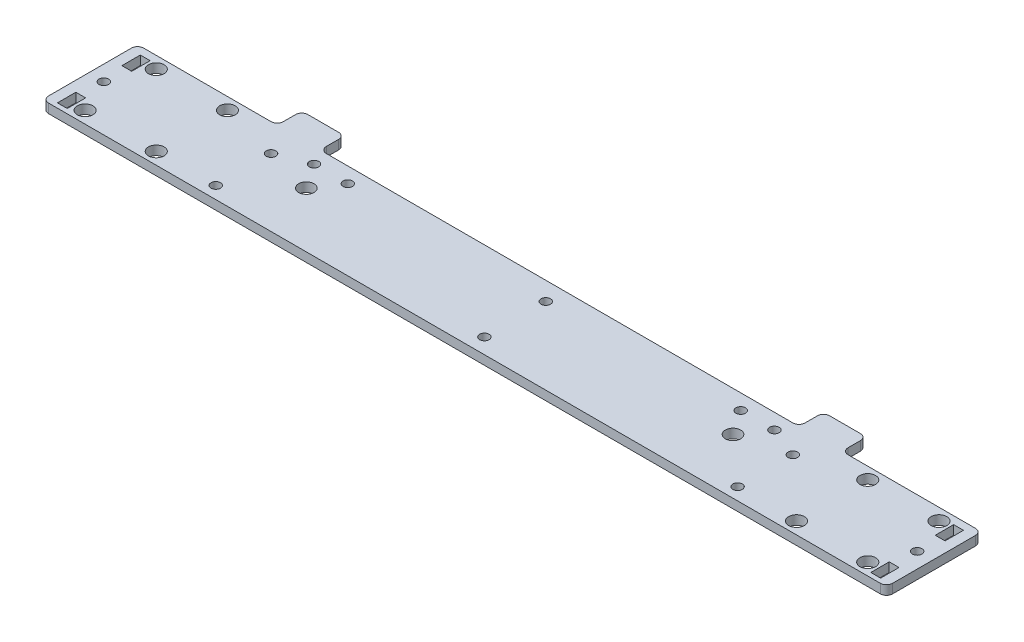
from build123d import *

# Parameters (mm, degrees)
CROQUIS1_R              = 1.55
CROQUIS1_R_2            = 2.55
CROQUIS1_R_3            = 2.5
CROQUIS1_W              = 3.2
CROQUIS1_H              = 6
SALIENTE_EXTRUIR1_DEPTH = 3
REDONDEO2_R             = 2


with BuildPart() as part:
    # Croquis1 → Saliente-Extruir1 (new body)
    with BuildSketch(Plane(origin=(0, 0, 0), x_dir=(1, 0, 0), z_dir=(0, 1, 0))):
        Polygon((0, 0), (275, 0), (275, 31), (229.5, 31), (229.5, 39), (215.5, 39), (215.5, 31), (59.5, 31), (59.5, 39), (45.5, 39), (45.5, 31), (0, 31), align=None)
        with Locations((5, 15)):
            Circle(CROQUIS1_R, mode=Mode.SUBTRACT)
        with Locations((270, 15)):
            Circle(CROQUIS1_R, mode=Mode.SUBTRACT)
        with Locations((10, 27.1)):
            Circle(CROQUIS1_R_2, mode=Mode.SUBTRACT)
        with Locations((33.2, 27.1)):
            Circle(CROQUIS1_R_2, mode=Mode.SUBTRACT)
        with Locations((33.2, 3.9)):
            Circle(CROQUIS1_R_2, mode=Mode.SUBTRACT)
        with Locations((10, 3.9)):
            Circle(CROQUIS1_R_2, mode=Mode.SUBTRACT)
        with Locations((265, 3.9)):
            Circle(CROQUIS1_R_2, mode=Mode.SUBTRACT)
        with Locations((241.8, 3.9)):
            Circle(CROQUIS1_R_2, mode=Mode.SUBTRACT)
        with Locations((265, 27.1)):
            Circle(CROQUIS1_R_2, mode=Mode.SUBTRACT)
        with Locations((241.8, 27.1)):
            Circle(CROQUIS1_R_2, mode=Mode.SUBTRACT)
        with Locations((139, 25)):
            Circle(CROQUIS1_R, mode=Mode.SUBTRACT)
        with Locations((139, 5)):
            Circle(CROQUIS1_R, mode=Mode.SUBTRACT)
        with Locations((52.5, 22)):
            Circle(CROQUIS1_R, mode=Mode.SUBTRACT)
        with Locations((52.5, 4)):
            Circle(CROQUIS1_R, mode=Mode.SUBTRACT)
        with Locations((222.5, 22)):
            Circle(CROQUIS1_R, mode=Mode.SUBTRACT)
        with Locations((222.5, 4)):
            Circle(CROQUIS1_R, mode=Mode.SUBTRACT)
        with Locations((212.5, 26)):
            Circle(CROQUIS1_R, mode=Mode.SUBTRACT)
        with Locations((62.5, 26)):
            Circle(CROQUIS1_R, mode=Mode.SUBTRACT)
        with Locations((201.5, 26)):
            Circle(CROQUIS1_R, mode=Mode.SUBTRACT)
        with Locations((73.5, 26)):
            Circle(CROQUIS1_R, mode=Mode.SUBTRACT)
        with Locations((207, 18)):
            Circle(CROQUIS1_R_3, mode=Mode.SUBTRACT)
        with Locations((68, 18)):
            Circle(CROQUIS1_R_3, mode=Mode.SUBTRACT)
        with Locations((270, 4.5)):
            Rectangle(CROQUIS1_W, CROQUIS1_H, mode=Mode.SUBTRACT)
        with Locations((5, 25.5)):
            Rectangle(CROQUIS1_W, CROQUIS1_H, mode=Mode.SUBTRACT)
        with Locations((5, 4.5)):
            Rectangle(CROQUIS1_W, CROQUIS1_H, mode=Mode.SUBTRACT)
        with Locations((270, 25.5)):
            Rectangle(CROQUIS1_W, CROQUIS1_H, mode=Mode.SUBTRACT)
    extrude(amount=SALIENTE_EXTRUIR1_DEPTH)

    # Redondeo2
    redondeo2_edges = [part.edges().sort_by_distance(p)[0] for p in [
        (275, 1.5, 0),
        (275, 1.5, -31),
        (229.5, 1.5, -31),
        (229.5, 1.5, -39),
        (215.5, 1.5, -39),
        (215.5, 1.5, -31),
        (59.5, 1.5, -31),
        (59.5, 1.5, -39),
        (0, 1.5, 0),
        (45.5, 1.5, -39),
        (45.5, 1.5, -31),
        (0, 1.5, -31),
    ]]
    fillet(redondeo2_edges, radius=REDONDEO2_R)


solid = part.part
